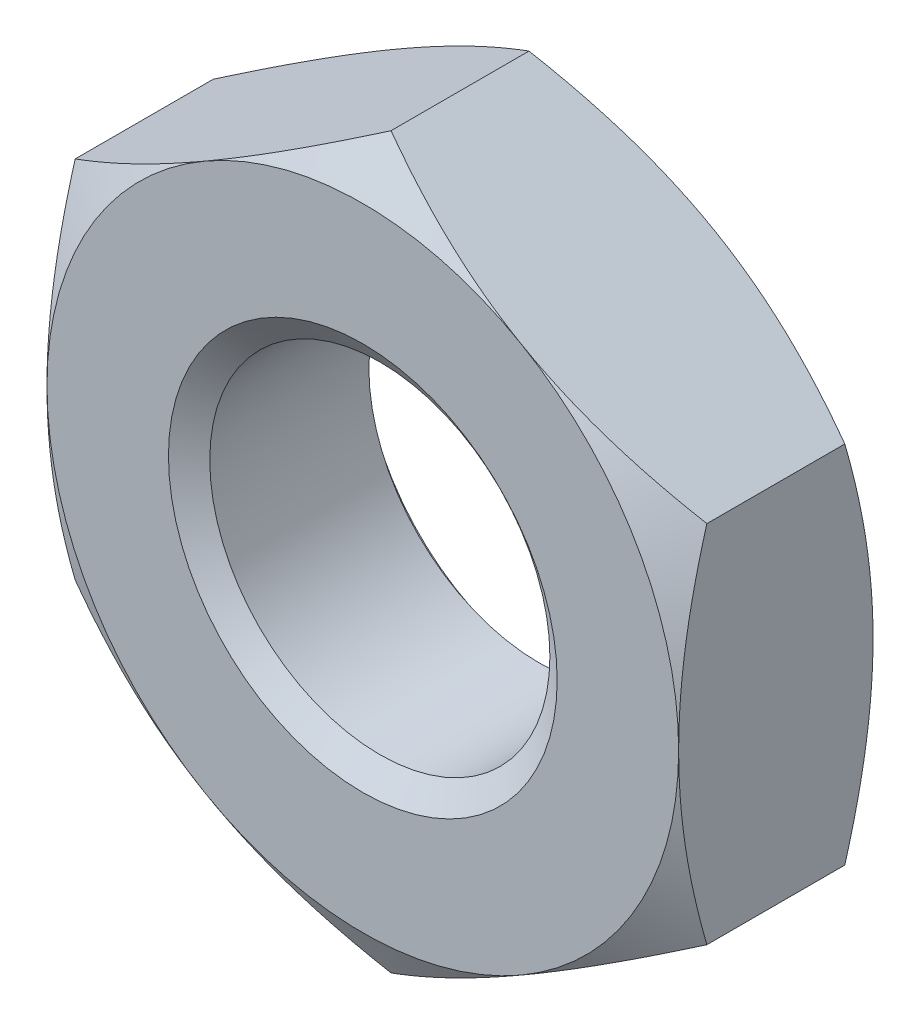
from build123d import *

# Parameters (mm, degrees)
BASENUTSKE_R  = 3.5
BASENUT_DEPTH = 4


# Read off the part's stored shape, not the designer's step: ThreadSchematic
with BuildPart() as part:
    # BaseNutSke → BaseNut (new body)
    with BuildSketch(Plane.XY):
        Polygon((6.5, 3.75277675), (6.5, -3.75277675), (0, -7.505553499), (-6.5, -3.75277675), (-6.5, 3.75277675), (0, 7.505553499), align=None)
        Circle(BASENUTSKE_R, mode=Mode.SUBTRACT)
    extrude(amount=-BASENUT_DEPTH)

    # Sketch3 → Double-Chamfer (revolve, cut)
    with BuildSketch(Plane(origin=(0, 0, 0), x_dir=(0, 0, -1), z_dir=(1, 0, 0))):
        Polygon((4, 6.5), (3.419443416, 7.505553499), (3.419443416, 17.505553499), (14, 17.505553499), (14, 6.5), align=None)
        Polygon((0.580556584, 17.505553499), (-10, 17.505553499), (-10, 6.5), (0, 6.5), (0.580556584, 7.505553499), align=None)
    revolve(axis=Axis((0, 0, 0), (0, 0, -1)), mode=Mode.SUBTRACT)

    # ThreadSchematic outline → ThreadSchematic (revolve, cut)
    with BuildSketch(Plane.XZ):
        Polygon((3.5, 0), (3.5, -0.350103769), (4, 0), align=None)
        Polygon((4, -3.9746), (3.5, -3.624496231), (3.5, -4), (4, -4), align=None)
    revolve(axis=Axis((0, 0, 0), (0, 0, 1)), mode=Mode.SUBTRACT)


solid = part.part
